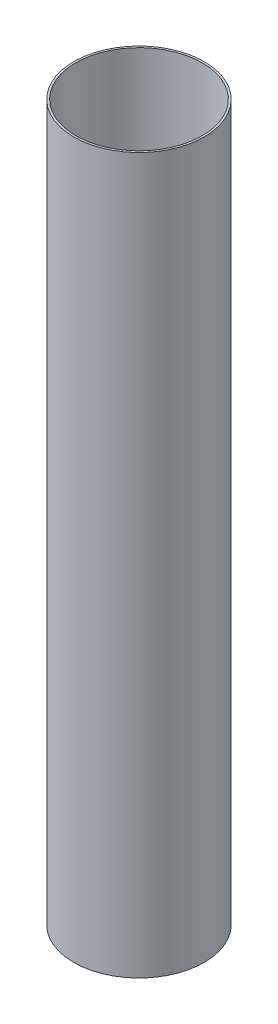
from build123d import *

# Parameters (mm, degrees)
SKETCH1_R           = 51.105
BOSS_EXTRUDE1_DEPTH = 560
SKETCH3_R           = 49.53
CUT_EXTRUDE1_DEPTH  = 565.644527158


with BuildPart() as part:
    # Sketch1 → Boss-Extrude1 (new body)
    with BuildSketch(Plane(origin=(0, 0, 0), x_dir=(1, 0, 0), z_dir=(0, 1, 0))):
        Circle(SKETCH1_R)
    extrude(amount=BOSS_EXTRUDE1_DEPTH)

    # Sketch3 → Cut-Extrude1 (cut, through all)
    with BuildSketch(Plane.XZ):
        Circle(SKETCH3_R)
    extrude(amount=-CUT_EXTRUDE1_DEPTH, mode=Mode.SUBTRACT)


solid = part.part
